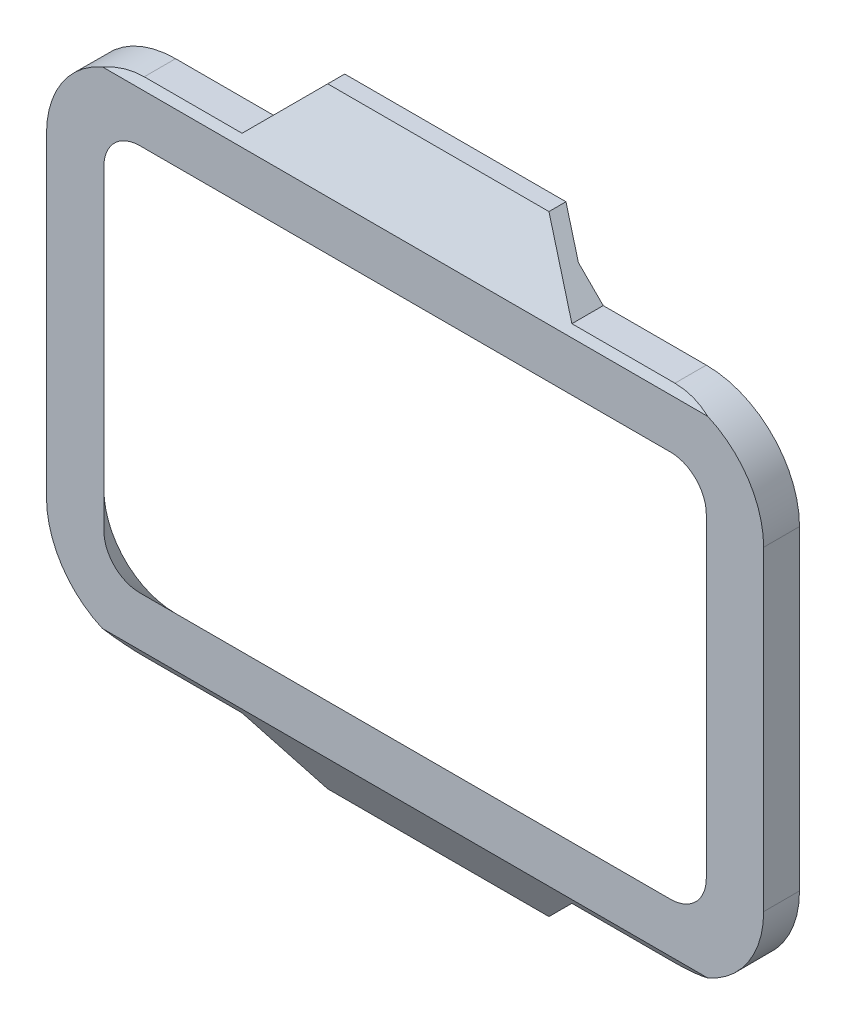
from build123d import *

# Parameters (mm, degrees)
BOSS_EXTRUDE1_DEPTH       = 5
CHAMFER1_SIZE             = 5
BOSS_EXTRUDE2_DEPTH       = 8
CHAMFER2_SIZE2            = 5
CHAMFER2_SIZE             = 8.660254038
CHAMFER2_OF_MIRROR1_SIZE2 = 5
CHAMFER2_OF_MIRROR1_SIZE  = 8.660254038


# Some blends are built 0.0001 mm under size
with BuildPart() as part:
    # Sketch1 → Boss-Extrude1 (new body)
    # profile 1 of 2: a face of its own
    with BuildSketch(Plane.XY):
        with BuildLine():
            Line((-41.988438617, -31.098685124), (-41.988438617, -75.098685124))
            ThreePointArc((-41.988438617, -75.098685124), (-38.180826772, -84.291073279), (-28.988438617, -88.098685124))
            Line((-28.988438617, -88.098685124), (45.011561383, -88.098685124))
            ThreePointArc((45.011561383, -88.098685124), (54.203949538, -84.291073279), (58.011561383, -75.098685124))
            Line((58.011561383, -75.098685124), (58.011561383, -31.098685124))
            ThreePointArc((58.011561383, -31.098685124), (54.203949538, -21.906296968), (45.011561383, -18.098685124))
            Line((45.011561383, -18.098685124), (-28.988438617, -18.098685124))
            ThreePointArc((-28.988438617, -18.098685124), (-38.180826772, -21.906296968), (-41.988438617, -31.098685124))
        make_face()
        with BuildLine():
            ThreePointArc((-38.988438617, -75.098685124), (-36.059506429, -82.169752935), (-28.988438617, -85.098685124))
            Line((-28.988438617, -85.098685124), (45.011561383, -85.098685124))
            ThreePointArc((45.011561383, -85.098685124), (52.082629195, -82.169752935), (55.011561383, -75.098685124))
            Line((55.011561383, -75.098685124), (55.011561383, -31.098685124))
            ThreePointArc((55.011561383, -31.098685124), (52.082629195, -24.027617312), (45.011561383, -21.098685124))
            Line((45.011561383, -21.098685124), (-28.988438617, -21.098685124))
            ThreePointArc((-28.988438617, -21.098685124), (-36.059506429, -24.027617312), (-38.988438617, -31.098685124))
            Line((-38.988438617, -31.098685124), (-38.988438617, -75.098685124))
        make_face(mode=Mode.SUBTRACT)
    # profile 2 of 2: a face of its own
    with BuildSketch(Plane.XY):
        with BuildLine():
            Line((-38.988438617, -31.098685124), (-38.988438617, -75.098685124))
            ThreePointArc((-38.988438617, -75.098685124), (-36.059506429, -82.169752935), (-28.988438617, -85.098685124))
            Line((-28.988438617, -85.098685124), (45.011561383, -85.098685124))
            ThreePointArc((45.011561383, -85.098685124), (52.082629195, -82.169752935), (55.011561383, -75.098685124))
            Line((55.011561383, -75.098685124), (55.011561383, -31.098685124))
            ThreePointArc((55.011561383, -31.098685124), (52.082629195, -24.027617312), (45.011561383, -21.098685124))
            Line((45.011561383, -21.098685124), (-28.988438617, -21.098685124))
            ThreePointArc((-28.988438617, -21.098685124), (-36.059506429, -24.027617312), (-38.988438617, -31.098685124))
        make_face()
        with BuildLine():
            ThreePointArc((-33.988438617, -75.098685124), (-32.523972523, -78.63421903), (-28.988438617, -80.098685124))
            Line((-28.988438617, -80.098685124), (45.011561383, -80.098685124))
            ThreePointArc((45.011561383, -80.098685124), (48.547095289, -78.63421903), (50.011561383, -75.098685124))
            Line((50.011561383, -75.098685124), (50.011561383, -31.098685124))
            ThreePointArc((50.011561383, -31.098685124), (48.547095289, -27.563151218), (45.011561383, -26.098685124))
            Line((45.011561383, -26.098685124), (-28.988438617, -26.098685124))
            ThreePointArc((-28.988438617, -26.098685124), (-32.523972523, -27.563151218), (-33.988438617, -31.098685124))
            Line((-33.988438617, -31.098685124), (-33.988438617, -75.098685124))
        make_face(mode=Mode.SUBTRACT)
    extrude(amount=-BOSS_EXTRUDE1_DEPTH)

    # Chamfer1
    chamfer1_edges = [part.edges().sort_by_distance(p)[0] for p in [
        (8.011561383, -80.098685124, -5),
        (48.547095289, -78.63421903, -5),
        (-32.523972523, -78.63421903, -5),
        (50.011561383, -53.098685124, -5),
        (-33.988438617, -53.098685124, -5),
        (48.547095289, -27.563151218, -5),
        (-32.523972523, -27.563151218, -5),
        (8.011561383, -26.098685124, -5),
    ]]
    chamfer(chamfer1_edges, length=CHAMFER1_SIZE - 0.0001)  # a hair under: the kernel refuses the full size

    # Sketch2 → Boss-Extrude2 (add)
    with BuildSketch(Plane.XY):
        Polygon((-15.345428916, -18.098685124), (-7.774377041, -10.527633249), (23.073373404, -10.527633249), (30.644425279, -18.098685124), align=None)
    boss_extrude2 = extrude(amount=-BOSS_EXTRUDE2_DEPTH)

    # Chamfer2
    chamfer2_edges = [part.edges().sort_by_distance(p)[0] for p in [
        (7.649498182, -10.527633249, 0),
    ]]
    chamfer2_side = [part.faces().sort_by_distance(p)[0] for p in [
        (7.649498182, -10.627633249, 0),
    ]]
    chamfer(chamfer2_edges, length=CHAMFER2_SIZE, length2=CHAMFER2_SIZE2, reference=chamfer2_side[0])
    # the kernel refuses this chamfer: 8.660254038, 5 mm, written as the material it takes off along each edge
    with BuildSketch(Plane(origin=(53.049245132, -18.098685124, -8), x_dir=(0, -0.05789386240267115, 0.9983227437537926), z_dir=(-1, 0, 0))) as chamfer2_2_piece_1_section:
        with BuildLine():
            Line((5.181896449, 0), (-0.691658286, 8.935197885))
            Line((-0.691658286, 8.935197885), (-0.864572857, 8.925170374))
            ThreePointArc((-0.864572857, 8.925170374), (-0.432286429, 4.462585187), (-0.172914571, -0.010027511))
            Line((-0.172914571, -0.010027511), (0.010027511, -0.172914571))
            ThreePointArc((0.010027511, -0.172914571), (2.592291656, -0.02316616), (5.19192396, -0.172914571))
            Line((5.19192396, -0.172914571), (5.181896449, 0))
        make_face()
    chamfer2_2_piece_1 = extrude(amount=90.7994939, mode=Mode.PRIVATE)
    chamfer2_2_piece_1 = split(chamfer2_2_piece_1, bisect_by=Plane(origin=(7.649498182, -14.797310686, -5), z_dir=(0, 0, -1)), keep=Keep.TOP, mode=Mode.PRIVATE)
    add(chamfer2_2_piece_1, mode=Mode.SUBTRACT)

    # Mirror1: Boss-Extrude2 across plane
    add(boss_extrude2.mirror(Plane.ZX.offset(-53.098685124)))

    # Chamfer2 of Mirror1
    chamfer2_of_mirror1_edges = [part.edges().sort_by_distance(p)[0] for p in [
        (7.649498182, -95.669736998, 0),
    ]]
    chamfer2_of_mirror1_side = [part.faces().sort_by_distance(p)[0] for p in [
        (7.649498182, -95.569736998, 0),
    ]]
    chamfer(chamfer2_of_mirror1_edges, length=CHAMFER2_OF_MIRROR1_SIZE, length2=CHAMFER2_OF_MIRROR1_SIZE2, reference=chamfer2_of_mirror1_side[0])
    # the kernel refuses this chamfer: 8.660254038, 5 mm, written as the material it takes off along each edge
    with BuildSketch(Plane(origin=(53.049245132, -88.098685124, -8), x_dir=(0, 0.057893862402670464, 0.9983227437537926), z_dir=(-1, 0, 0))) as chamfer2_of_mirror1_2_piece_1_section:
        with BuildLine():
            Line((5.181896449, 0), (-0.691658286, -8.935197885))
            Line((-0.691658286, -8.935197885), (-0.864572857, -8.925170374))
            ThreePointArc((-0.864572857, -8.925170374), (-0.432286429, -4.462585187), (-0.172914571, 0.010027511))
            Line((-0.172914571, 0.010027511), (0.010027511, 0.172914571))
            ThreePointArc((0.010027511, 0.172914571), (2.592291656, 0.02316616), (5.19192396, 0.172914571))
            Line((5.19192396, 0.172914571), (5.181896449, 0))
        make_face()
    chamfer2_of_mirror1_2_piece_1 = extrude(amount=90.7994939, mode=Mode.PRIVATE)
    chamfer2_of_mirror1_2_piece_1 = split(chamfer2_of_mirror1_2_piece_1, bisect_by=Plane(origin=(7.649498182, -91.400059561, -5), z_dir=(0, 0, -1)), keep=Keep.TOP, mode=Mode.PRIVATE)
    add(chamfer2_of_mirror1_2_piece_1, mode=Mode.SUBTRACT)


solid = part.part
